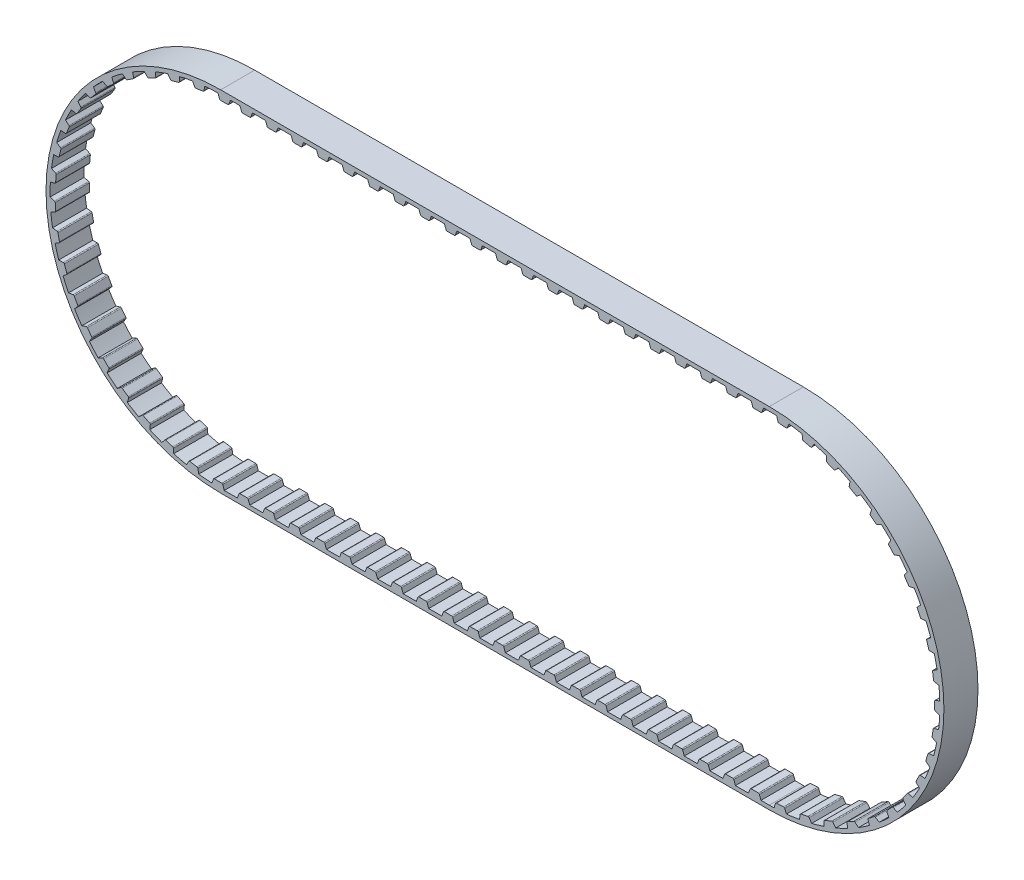
from build123d import *

# Parameters (mm, degrees)
BOSS_EXTRUDE1_DEPTH      = 6.35
BOSS_EXTRUDE1_DEPTH_BACK = 6.35
BOSS_EXTRUDE2_DEPTH      = 6.35
CRVPATTERN1_START        = -6.35
CRVPATTERN1_DEPTH        = 12.7


# Read off the part's stored shape, not the designer's step: CrvPattern1
with BuildPart() as part:
    # Sketch4 → Boss-Extrude1 (new, two sides: drawn at the far end of the back side and taken through both)
    with BuildSketch(Plane.XY.offset(-BOSS_EXTRUDE1_DEPTH_BACK)):
        with BuildLine():
            Line((-102.235, -65.084822428), (102.235, -65.084822428))
            ThreePointArc((102.235, -65.084822428), (167.319822428, 0), (102.235, 65.084822428))
            Line((102.235, 65.084822428), (-102.235, 65.084822428))
            ThreePointArc((-102.235, 65.084822428), (-167.319822428, 0), (-102.235, -65.084822428))
        make_face()
        with BuildLine():
            Line((-102.235, -63.560822428), (102.235, -63.560822428))
            ThreePointArc((102.235, -63.560822428), (165.795822428, 0), (102.235, 63.560822428))
            Line((102.235, 63.560822428), (-102.235, 63.560822428))
            ThreePointArc((-102.235, 63.560822428), (-165.795822428, 0), (-102.235, -63.560822428))
        make_face(mode=Mode.SUBTRACT)
    extrude(amount=BOSS_EXTRUDE1_DEPTH + BOSS_EXTRUDE1_DEPTH_BACK)

    # Sketch5 → Boss-Extrude2 (add, symmetric)
    with BuildSketch(Plane.XY):
        with BuildLine():
            Line((-95.049570389, 63.603326971), (-94.435782346, 61.916958184))
            ThreePointArc((-94.435782346, 61.916958184), (-94.290479985, 61.72759646), (-94.062841837, 61.655822428))
            Line((-94.062841837, 61.655822428), (-91.357158163, 61.655822428))
            ThreePointArc((-91.357158163, 61.655822428), (-91.129520015, 61.72759646), (-90.984217654, 61.916958184))
            Line((-90.984217654, 61.916958184), (-90.370429611, 63.603326971))
            Line((-90.370429611, 63.603326971), (-95.049570389, 63.603326971))
        make_face()
    extrude(amount=BOSS_EXTRUDE2_DEPTH, both=True)

    # CrvPattern1 outline → CrvPattern1 (add)
    with BuildSketch(Plane.XY.offset(CRVPATTERN1_START)):
        with BuildLine():
            ThreePointArc((-102.235, 63.560822428), (-102.735344741, 63.558853064), (-103.235658477, 63.552945096))
            Line((-103.235658477, 63.552945096), (-102.640207938, 61.916958184))
            ThreePointArc((-102.640207938, 61.916958184), (-102.494905577, 61.72759646), (-102.267267429, 61.655822428))
            Line((-102.267267429, 61.655822428), (-99.561583755, 61.655822428))
            ThreePointArc((-99.561583755, 61.655822428), (-99.333945607, 61.72759646), (-99.188643246, 61.916958184))
            Line((-99.188643246, 61.916958184), (-98.590325592, 63.560822428))
            Line((-98.590325592, 63.560822428), (-102.235, 63.560822428))
        make_face()
        with BuildLine():
            ThreePointArc((-108.121637287, 63.287642152), (-110.416661388, 63.032043951), (-112.700886314, 62.693248212))
            Line((-112.700886314, 62.693248212), (-111.916485406, 61.179709674))
            ThreePointArc((-111.916485406, 61.179709674), (-111.748016877, 61.010626875), (-111.513033627, 60.968751934))
            Line((-111.513033627, 60.968751934), (-108.829859216, 61.317032318))
            ThreePointArc((-108.829859216, 61.317032318), (-108.613353727, 61.417511228), (-108.493635149, 61.62400118))
            Line((-108.493635149, 61.62400118), (-108.121637287, 63.287642152))
        make_face()
        with BuildLine():
            ThreePointArc((-117.504267711, 61.699494417), (-119.735410529, 61.104122439), (-121.943454126, 60.428097634))
            Line((-121.943454126, 60.428097634), (-120.941878817, 59.048630131))
            ThreePointArc((-120.941878817, 59.048630131), (-120.750054975, 58.906594037), (-120.511453527, 58.900270515))
            Line((-120.511453527, 58.900270515), (-117.910347685, 59.645235311))
            ThreePointArc((-117.910347685, 59.645235311), (-117.711269798, 59.776911554), (-117.62372113, 59.998960803))
            Line((-117.62372113, 59.998960803), (-117.504267711, 61.699494417))
        make_face()
        with BuildLine():
            ThreePointArc((-126.544638041, 58.728354702), (-128.661888588, 57.80655419), (-130.744257638, 56.808453391))
            Line((-130.744257638, 56.808453391), (-129.547958203, 55.593977638))
            ThreePointArc((-129.547958203, 55.593977638), (-129.337078774, 55.482171982), (-129.100207369, 55.511541623))
            Line((-129.100207369, 55.511541623), (-126.639473792, 56.636492469))
            ThreePointArc((-126.639473792, 56.636492469), (-126.46228583, 56.796414526), (-126.408869473, 57.029045846))
            Line((-126.408869473, 57.029045846), (-126.544638041, 58.728354702))
        make_face()
        with BuildLine():
            ThreePointArc((-135.040108696, 54.440821), (-136.996008877, 53.213254078), (-138.906027151, 51.915449679))
            Line((-138.906027151, 51.915449679), (-137.5418186, 50.893188108))
            ThreePointArc((-137.5418186, 50.893188108), (-137.316610438, 50.814119011), (-137.086778541, 50.878523493))
            Line((-137.086778541, 50.878523493), (-134.821574484, 52.358244658))
            ThreePointArc((-134.821574484, 52.358244658), (-134.67024811, 52.542827882), (-134.652161388, 52.78082685))
            Line((-134.652161388, 52.78082685), (-135.040108696, 54.440821))
        make_face()
        with BuildLine():
            ThreePointArc((-142.800254004, 48.932998226), (-144.550962385, 47.427180763), (-146.245816891, 45.858763004))
            Line((-146.245816891, 45.858763004), (-144.74427791, 45.051629571))
            ThreePointArc((-144.74427791, 45.051629571), (-144.509789048, 45.007069364), (-144.292148333, 45.105065064))
            Line((-144.292148333, 45.105065064), (-142.273248265, 46.90638865))
            ThreePointArc((-142.273248265, 46.90638865), (-142.151175453, 47.111495614), (-142.168823781, 47.349527491))
            Line((-142.168823781, 47.349527491), (-142.800254004, 48.932998226))
        make_face()
        with BuildLine():
            ThreePointArc((-149.651130581, 42.328344031), (-151.157405096, 40.578028874), (-152.599105731, 38.774153783))
            Line((-152.599105731, 38.774153783), (-150.993893263, 38.200240355))
            ThreePointArc((-150.993893263, 38.200240355), (-150.755379761, 38.191187853), (-150.554808636, 38.320578201))
            Line((-150.554808636, 38.320578201), (-148.827466131, 40.403127603))
            ThreePointArc((-148.827466131, 40.403127603), (-148.737383139, 40.624160842), (-148.79037093, 40.856890153))
            Line((-148.79037093, 40.856890153), (-149.651130581, 42.328344031))
        make_face()
        with BuildLine():
            ThreePointArc((-155.439176273, 34.774901507), (-156.667253833, 32.819321907), (-157.823484928, 30.82042328))
            Line((-157.823484928, 30.82042328), (-156.150579753, 30.492594107))
            ThreePointArc((-156.150579753, 30.492594107), (-155.913387883, 30.519252221), (-155.734382143, 30.677136936))
            Line((-155.734382143, 30.677136936), (-154.337315521, 32.994231884))
            ThreePointArc((-154.337315521, 32.994231884), (-154.281241557, 33.226236946), (-154.36838109, 33.448447072))
            Line((-154.36838109, 33.448447072), (-155.439176273, 34.774901507))
        make_face()
        with BuildLine():
            ThreePointArc((-160.034652241, 26.441980798), (-160.95700553, 24.324971002), (-161.801850206, 22.175854082))
            Line((-161.801850206, 22.175854082), (-160.098750434, 22.101457443))
            ThreePointArc((-160.098750434, 22.101457443), (-159.868196843, 22.163228632), (-159.714768896, 22.346068736))
            Line((-159.714768896, 22.346068736), (-158.679293357, 24.845771628))
            ThreePointArc((-158.679293357, 24.845771628), (-158.658485315, 25.083548127), (-158.777823363, 25.290258235))
            Line((-158.777823363, 25.290258235), (-160.034652241, 26.441980798))
        make_face()
        with BuildLine():
            ThreePointArc((-163.334551054, 17.516364028), (-163.930505556, 15.285376736), (-164.445026649, 13.034213901))
            Line((-164.445026649, 13.034213901), (-162.749907202, 13.214917394))
            ThreePointArc((-162.749907202, 13.214917394), (-162.53115974, 13.31041706), (-162.406748668, 13.514114196))
            Line((-162.406748668, 13.514114196), (-161.756074358, 16.140394282))
            ThreePointArc((-161.756074358, 16.140394282), (-161.770998651, 16.378612467), (-161.919860255, 16.565189157))
            Line((-161.919860255, 16.565189157), (-163.334551054, 17.516364028))
        make_face()
        with BuildLine():
            ThreePointArc((-165.264905596, 8.198118579), (-165.521103012, 5.903161292), (-165.693767551, 3.600412278))
            Line((-165.693767551, 3.600412278), (-164.044624471, 4.03216544))
            ThreePointArc((-164.044624471, 4.03216544), (-163.842586356, 4.159252962), (-163.749980828, 4.379241267))
            Line((-163.749980828, 4.379241267), (-163.498692589, 7.07323057))
            ThreePointArc((-163.498692589, 7.07323057), (-163.549014689, 7.306550789), (-163.724063121, 7.468811951))
            Line((-163.724063121, 7.468811951), (-165.264905596, 8.198118579))
        make_face()
        with BuildLine():
            ThreePointArc((-165.78244704, -1.303887407), (-165.693144714, -3.611373303), (-165.52008243, -5.914092459))
            Line((-165.52008243, -5.914092459), (-163.9538812, -5.240967358))
            ThreePointArc((-163.9538812, -5.240967358), (-163.773081107, -5.085140644), (-163.714356874, -4.8537922))
            Line((-163.714356874, -4.8537922), (-163.868087323, -2.152479354))
            ThreePointArc((-163.868087323, -2.152479354), (-163.952679263, -1.929286966), (-164.149990817, -1.794978409))
            Line((-164.149990817, -1.794978409), (-165.78244704, -1.303887407))
        make_face()
        with BuildLine():
            ThreePointArc((-164.875574713, -10.776666803), (-164.442774353, -13.044959093), (-163.927864429, -15.296033023))
            Line((-163.927864429, -15.296033023), (-162.479711395, -14.39662406))
            ThreePointArc((-162.479711395, -14.39662406), (-162.324201954, -14.215551003), (-162.300675315, -13.978028087))
            Line((-162.300675315, -13.978028087), (-162.85597859, -11.32994153))
            ThreePointArc((-162.85597859, -11.32994153), (-162.972944244, -11.121879822), (-163.188096191, -11.018534392))
            Line((-163.188096191, -11.018534392), (-164.875574713, -10.776666803))
        make_face()
        with BuildLine():
            ThreePointArc((-162.564616124, -20.007887595), (-161.798018936, -22.186142588), (-160.952803061, -24.335113549))
            Line((-160.952803061, -24.335113549), (-159.655158521, -23.229580944))
            ThreePointArc((-159.655158521, -23.229580944), (-159.528425469, -23.027320291), (-159.540623775, -22.788946971))
            Line((-159.540623775, -22.788946971), (-160.485052773, -20.253443468))
            ThreePointArc((-160.485052773, -20.253443468), (-160.631770359, -20.065176137), (-160.859940075, -19.995110318))
            Line((-160.859940075, -19.995110318), (-162.564616124, -20.007887595))
        make_face()
        with BuildLine():
            ThreePointArc((-158.90137133, -28.790632296), (-157.818160562, -30.830024484), (-156.661584219, -32.828723368))
            Line((-156.661584219, -32.828723368), (-155.54353483, -31.541847594))
            ThreePointArc((-155.54353483, -31.541847594), (-155.448418885, -31.32293301), (-155.496068711, -31.089052416))
            Line((-155.496068711, -31.089052416), (-156.808454088, -28.722965189))
            ThreePointArc((-156.808454088, -28.722965189), (-156.981634937, -28.558712239), (-157.217708006, -28.523496555))
            Line((-157.217708006, -28.523496555), (-158.90137133, -28.790632296))
        make_face()
        with BuildLine():
            ThreePointArc((-153.967951832, -36.928035995), (-152.592407615, -38.782852474), (-151.150395422, -40.586478517))
            Line((-151.150395422, -40.586478517), (-150.237002222, -39.14710485))
            ThreePointArc((-150.237002222, -39.14710485), (-150.175635403, -38.916443297), (-150.25766868, -38.692297854))
            Line((-150.25766868, -38.692297854), (-151.908593365, -36.548662664))
            ThreePointArc((-151.908593365, -36.548662664), (-152.104355636, -36.41210582), (-152.343040488, -36.412529628))
            Line((-152.343040488, -36.412529628), (-153.967951832, -36.928035995))
        make_face()
        with BuildLine():
            ThreePointArc((-147.874940054, -44.237699077), (-146.237895162, -45.866364201), (-144.542769772, -47.434489189))
            Line((-144.542769772, -47.434489189), (-143.854506436, -45.874881138))
            ThreePointArc((-143.854506436, -45.874881138), (-143.828264279, -45.637642888), (-143.942842233, -45.428256807))
            Line((-143.942842233, -45.428256807), (-145.895300809, -43.555123162))
            ThreePointArc((-145.895300809, -43.555123162), (-146.109256496, -43.44932334), (-146.345203019, -43.485377141))
            Line((-146.345203019, -43.485377141), (-147.874940054, -44.237699077))
        make_face()
        with BuildLine():
            ThreePointArc((-140.758910638, -50.555775703), (-138.897059375, -51.921783002), (-136.986816963, -53.219257469))
            Line((-136.986816963, -53.219257469), (-136.539110889, -51.574373593))
            ThreePointArc((-136.539110889, -51.574373593), (-136.548581612, -51.335876332), (-136.693135982, -51.145942996))
            Line((-136.693135982, -51.145942996), (-138.903364158, -49.585297118))
            ThreePointArc((-138.903364158, -49.585297118), (-139.130717452, -49.512625819), (-139.358636913, -49.583501467))
            Line((-139.358636913, -49.583501467), (-140.758910638, -50.555775703))
        make_face()
        with BuildLine():
            ThreePointArc((-132.779369131, -55.740646409), (-130.734444828, -56.813376878), (-128.651903409, -57.811117979))
            Line((-128.651903409, -57.811117979), (-128.454789913, -56.117828293))
            ThreePointArc((-128.454789913, -56.117828293), (-128.499761229, -55.883417929), (-128.671051835, -55.717194686))
            Line((-128.671051835, -55.717194686), (-131.089507425, -54.504018398))
            ThreePointArc((-131.089507425, -54.504018398), (-131.325162211, -54.466104545), (-131.539945803, -54.570213367))
            Line((-131.539945803, -54.570213367), (-132.779369131, -55.740646409))
        make_face()
        with BuildLine():
            ThreePointArc((-124.115176673, -59.676092504), (-121.933016234, -60.431500926), (-119.724855901, -61.107144331))
            Line((-119.724855901, -61.107144331), (-119.782753277, -59.403403862))
            ThreePointArc((-119.782753277, -59.403403862), (-119.862217155, -59.178334694), (-120.056404524, -59.039547433))
            Line((-120.056404524, -59.039547433), (-122.628877932, -58.201034039))
            ThreePointArc((-122.628877932, -58.201034039), (-122.867552015, -58.19872747), (-123.064385372, -58.333735869))
            Line((-123.064385372, -58.333735869), (-124.115176673, -59.676092504))
        make_face()
        with BuildLine():
            ThreePointArc((-114.960540831, -62.273901101), (-112.690057306, -62.695055024), (-110.405773894, -63.033456209))
            Line((-110.405773894, -63.033456209), (-110.717384373, -61.35745424))
            ThreePointArc((-110.717384373, -61.35745424), (-110.829559633, -61.146771186), (-111.042291063, -61.038530818))
            Line((-111.042291063, -61.038530818), (-113.711120388, -60.593475566))
            ThreePointArc((-113.711120388, -60.593475566), (-113.947463898, -60.626827982), (-114.121935006, -60.789709751))
            Line((-114.121935006, -60.789709751), (-114.960540831, -62.273901101))
        make_face()
        with BuildLine():
            Line((-102.235, -63.560822428), (-100.898709621, -63.560822428))
            Line((-100.898709621, -63.560822428), (-101.461883124, -61.936179457))
            ThreePointArc((-101.461883124, -61.936179457), (-101.604255363, -61.744604971), (-101.830762484, -61.6693377))
            Line((-101.830762484, -61.6693377), (-104.536126012, -61.627716487))
            ThreePointArc((-104.536126012, -61.627716487), (-104.764841317, -61.695980296), (-104.913039414, -61.883084444))
            Line((-104.913039414, -61.883084444), (-105.520662443, -63.475842413))
            ThreePointArc((-105.520662443, -63.475842413), (-103.878380608, -63.539573873), (-102.235, -63.560822428))
        make_face()
        with BuildLine():
            Line((-96.011887204, -63.560822428), (-91.363687204, -63.560822428))
            Line((-91.363687204, -63.560822428), (-91.962004858, -61.916958184))
            ThreePointArc((-91.962004858, -61.916958184), (-92.107307219, -61.72759646), (-92.334945367, -61.655822428))
            Line((-92.334945367, -61.655822428), (-95.040629041, -61.655822428))
            ThreePointArc((-95.040629041, -61.655822428), (-95.268267189, -61.72759646), (-95.41356955, -61.916958184))
            Line((-95.41356955, -61.916958184), (-96.011887204, -63.560822428))
        make_face()
        with BuildLine():
            Line((-86.486887204, -63.560822428), (-81.838687204, -63.560822428))
            Line((-81.838687204, -63.560822428), (-82.437004858, -61.916958184))
            ThreePointArc((-82.437004858, -61.916958184), (-82.582307219, -61.72759646), (-82.809945367, -61.655822428))
            Line((-82.809945367, -61.655822428), (-85.515629041, -61.655822428))
            ThreePointArc((-85.515629041, -61.655822428), (-85.743267189, -61.72759646), (-85.88856955, -61.916958184))
            Line((-85.88856955, -61.916958184), (-86.486887204, -63.560822428))
        make_face()
        with BuildLine():
            Line((-76.961887204, -63.560822428), (-72.313687204, -63.560822428))
            Line((-72.313687204, -63.560822428), (-72.912004858, -61.916958184))
            ThreePointArc((-72.912004858, -61.916958184), (-73.057307219, -61.72759646), (-73.284945367, -61.655822428))
            Line((-73.284945367, -61.655822428), (-75.990629041, -61.655822428))
            ThreePointArc((-75.990629041, -61.655822428), (-76.218267189, -61.72759646), (-76.36356955, -61.916958184))
            Line((-76.36356955, -61.916958184), (-76.961887204, -63.560822428))
        make_face()
        with BuildLine():
            Line((-67.436887204, -63.560822428), (-62.788687204, -63.560822428))
            Line((-62.788687204, -63.560822428), (-63.387004858, -61.916958184))
            ThreePointArc((-63.387004858, -61.916958184), (-63.532307219, -61.72759646), (-63.759945367, -61.655822428))
            Line((-63.759945367, -61.655822428), (-66.465629041, -61.655822428))
            ThreePointArc((-66.465629041, -61.655822428), (-66.693267189, -61.72759646), (-66.83856955, -61.916958184))
            Line((-66.83856955, -61.916958184), (-67.436887204, -63.560822428))
        make_face()
        with BuildLine():
            Line((-57.911887204, -63.560822428), (-53.263687204, -63.560822428))
            Line((-53.263687204, -63.560822428), (-53.862004858, -61.916958184))
            ThreePointArc((-53.862004858, -61.916958184), (-54.007307219, -61.72759646), (-54.234945367, -61.655822428))
            Line((-54.234945367, -61.655822428), (-56.940629041, -61.655822428))
            ThreePointArc((-56.940629041, -61.655822428), (-57.168267189, -61.72759646), (-57.31356955, -61.916958184))
            Line((-57.31356955, -61.916958184), (-57.911887204, -63.560822428))
        make_face()
        with BuildLine():
            Line((-48.386887204, -63.560822428), (-43.738687204, -63.560822428))
            Line((-43.738687204, -63.560822428), (-44.337004858, -61.916958184))
            ThreePointArc((-44.337004858, -61.916958184), (-44.482307219, -61.72759646), (-44.709945367, -61.655822428))
            Line((-44.709945367, -61.655822428), (-47.415629041, -61.655822428))
            ThreePointArc((-47.415629041, -61.655822428), (-47.643267189, -61.72759646), (-47.78856955, -61.916958184))
            Line((-47.78856955, -61.916958184), (-48.386887204, -63.560822428))
        make_face()
        with BuildLine():
            Line((-38.861887204, -63.560822428), (-34.213687204, -63.560822428))
            Line((-34.213687204, -63.560822428), (-34.812004858, -61.916958184))
            ThreePointArc((-34.812004858, -61.916958184), (-34.957307219, -61.72759646), (-35.184945367, -61.655822428))
            Line((-35.184945367, -61.655822428), (-37.890629041, -61.655822428))
            ThreePointArc((-37.890629041, -61.655822428), (-38.118267189, -61.72759646), (-38.26356955, -61.916958184))
            Line((-38.26356955, -61.916958184), (-38.861887204, -63.560822428))
        make_face()
        with BuildLine():
            Line((-29.336887204, -63.560822428), (-24.688687204, -63.560822428))
            Line((-24.688687204, -63.560822428), (-25.287004858, -61.916958184))
            ThreePointArc((-25.287004858, -61.916958184), (-25.432307219, -61.72759646), (-25.659945367, -61.655822428))
            Line((-25.659945367, -61.655822428), (-28.365629041, -61.655822428))
            ThreePointArc((-28.365629041, -61.655822428), (-28.593267189, -61.72759646), (-28.73856955, -61.916958184))
            Line((-28.73856955, -61.916958184), (-29.336887204, -63.560822428))
        make_face()
        with BuildLine():
            Line((-19.811887204, -63.560822428), (-15.163687204, -63.560822428))
            Line((-15.163687204, -63.560822428), (-15.762004858, -61.916958184))
            ThreePointArc((-15.762004858, -61.916958184), (-15.907307219, -61.72759646), (-16.134945367, -61.655822428))
            Line((-16.134945367, -61.655822428), (-18.840629041, -61.655822428))
            ThreePointArc((-18.840629041, -61.655822428), (-19.068267189, -61.72759646), (-19.21356955, -61.916958184))
            Line((-19.21356955, -61.916958184), (-19.811887204, -63.560822428))
        make_face()
        with BuildLine():
            Line((-10.286887204, -63.560822428), (-5.638687204, -63.560822428))
            Line((-5.638687204, -63.560822428), (-6.237004858, -61.916958184))
            ThreePointArc((-6.237004858, -61.916958184), (-6.382307219, -61.72759646), (-6.609945367, -61.655822428))
            Line((-6.609945367, -61.655822428), (-9.315629041, -61.655822428))
            ThreePointArc((-9.315629041, -61.655822428), (-9.543267189, -61.72759646), (-9.68856955, -61.916958184))
            Line((-9.68856955, -61.916958184), (-10.286887204, -63.560822428))
        make_face()
        with BuildLine():
            Line((-0.761887204, -63.560822428), (3.886312796, -63.560822428))
            Line((3.886312796, -63.560822428), (3.287995142, -61.916958184))
            ThreePointArc((3.287995142, -61.916958184), (3.142692781, -61.72759646), (2.915054633, -61.655822428))
            Line((2.915054633, -61.655822428), (0.209370959, -61.655822428))
            ThreePointArc((0.209370959, -61.655822428), (-0.018267189, -61.72759646), (-0.16356955, -61.916958184))
            Line((-0.16356955, -61.916958184), (-0.761887204, -63.560822428))
        make_face()
        with BuildLine():
            Line((8.763112796, -63.560822428), (13.411312796, -63.560822428))
            Line((13.411312796, -63.560822428), (12.812995142, -61.916958184))
            ThreePointArc((12.812995142, -61.916958184), (12.667692781, -61.72759646), (12.440054633, -61.655822428))
            Line((12.440054633, -61.655822428), (9.734370959, -61.655822428))
            ThreePointArc((9.734370959, -61.655822428), (9.506732811, -61.72759646), (9.36143045, -61.916958184))
            Line((9.36143045, -61.916958184), (8.763112796, -63.560822428))
        make_face()
        with BuildLine():
            Line((18.288112796, -63.560822428), (22.936312796, -63.560822428))
            Line((22.936312796, -63.560822428), (22.337995142, -61.916958184))
            ThreePointArc((22.337995142, -61.916958184), (22.192692781, -61.72759646), (21.965054633, -61.655822428))
            Line((21.965054633, -61.655822428), (19.259370959, -61.655822428))
            ThreePointArc((19.259370959, -61.655822428), (19.031732811, -61.72759646), (18.88643045, -61.916958184))
            Line((18.88643045, -61.916958184), (18.288112796, -63.560822428))
        make_face()
        with BuildLine():
            Line((27.813112796, -63.560822428), (32.461312796, -63.560822428))
            Line((32.461312796, -63.560822428), (31.862995142, -61.916958184))
            ThreePointArc((31.862995142, -61.916958184), (31.717692781, -61.72759646), (31.490054633, -61.655822428))
            Line((31.490054633, -61.655822428), (28.784370959, -61.655822428))
            ThreePointArc((28.784370959, -61.655822428), (28.556732811, -61.72759646), (28.41143045, -61.916958184))
            Line((28.41143045, -61.916958184), (27.813112796, -63.560822428))
        make_face()
        with BuildLine():
            Line((37.338112796, -63.560822428), (41.986312796, -63.560822428))
            Line((41.986312796, -63.560822428), (41.387995142, -61.916958184))
            ThreePointArc((41.387995142, -61.916958184), (41.242692781, -61.72759646), (41.015054633, -61.655822428))
            Line((41.015054633, -61.655822428), (38.309370959, -61.655822428))
            ThreePointArc((38.309370959, -61.655822428), (38.081732811, -61.72759646), (37.93643045, -61.916958184))
            Line((37.93643045, -61.916958184), (37.338112796, -63.560822428))
        make_face()
        with BuildLine():
            Line((46.863112796, -63.560822428), (51.511312796, -63.560822428))
            Line((51.511312796, -63.560822428), (50.912995142, -61.916958184))
            ThreePointArc((50.912995142, -61.916958184), (50.767692781, -61.72759646), (50.540054633, -61.655822428))
            Line((50.540054633, -61.655822428), (47.834370959, -61.655822428))
            ThreePointArc((47.834370959, -61.655822428), (47.606732811, -61.72759646), (47.46143045, -61.916958184))
            Line((47.46143045, -61.916958184), (46.863112796, -63.560822428))
        make_face()
        with BuildLine():
            Line((56.388112796, -63.560822428), (61.036312796, -63.560822428))
            Line((61.036312796, -63.560822428), (60.437995142, -61.916958184))
            ThreePointArc((60.437995142, -61.916958184), (60.292692781, -61.72759646), (60.065054633, -61.655822428))
            Line((60.065054633, -61.655822428), (57.359370959, -61.655822428))
            ThreePointArc((57.359370959, -61.655822428), (57.131732811, -61.72759646), (56.98643045, -61.916958184))
            Line((56.98643045, -61.916958184), (56.388112796, -63.560822428))
        make_face()
        with BuildLine():
            Line((65.913112796, -63.560822428), (70.561312796, -63.560822428))
            Line((70.561312796, -63.560822428), (69.962995142, -61.916958184))
            ThreePointArc((69.962995142, -61.916958184), (69.817692781, -61.72759646), (69.590054633, -61.655822428))
            Line((69.590054633, -61.655822428), (66.884370959, -61.655822428))
            ThreePointArc((66.884370959, -61.655822428), (66.656732811, -61.72759646), (66.51143045, -61.916958184))
            Line((66.51143045, -61.916958184), (65.913112796, -63.560822428))
        make_face()
        with BuildLine():
            Line((75.438112796, -63.560822428), (80.086312796, -63.560822428))
            Line((80.086312796, -63.560822428), (79.487995142, -61.916958184))
            ThreePointArc((79.487995142, -61.916958184), (79.342692781, -61.72759646), (79.115054633, -61.655822428))
            Line((79.115054633, -61.655822428), (76.409370959, -61.655822428))
            ThreePointArc((76.409370959, -61.655822428), (76.181732811, -61.72759646), (76.03643045, -61.916958184))
            Line((76.03643045, -61.916958184), (75.438112796, -63.560822428))
        make_face()
        with BuildLine():
            Line((84.963112796, -63.560822428), (89.611312796, -63.560822428))
            Line((89.611312796, -63.560822428), (89.012995142, -61.916958184))
            ThreePointArc((89.012995142, -61.916958184), (88.867692781, -61.72759646), (88.640054633, -61.655822428))
            Line((88.640054633, -61.655822428), (85.934370959, -61.655822428))
            ThreePointArc((85.934370959, -61.655822428), (85.706732811, -61.72759646), (85.56143045, -61.916958184))
            Line((85.56143045, -61.916958184), (84.963112796, -63.560822428))
        make_face()
        with BuildLine():
            Line((94.488112796, -63.560822428), (99.136312796, -63.560822428))
            Line((99.136312796, -63.560822428), (98.537995142, -61.916958184))
            ThreePointArc((98.537995142, -61.916958184), (98.392692781, -61.72759646), (98.165054633, -61.655822428))
            Line((98.165054633, -61.655822428), (95.459370959, -61.655822428))
            ThreePointArc((95.459370959, -61.655822428), (95.231732811, -61.72759646), (95.08643045, -61.916958184))
            Line((95.08643045, -61.916958184), (94.488112796, -63.560822428))
        make_face()
        with BuildLine():
            ThreePointArc((104.027634738, -63.535538153), (106.334365492, -63.428490052), (108.635685393, -63.237721134))
            Line((108.635685393, -63.237721134), (107.950533504, -61.67674369))
            ThreePointArc((107.950533504, -61.67674369), (107.793320745, -61.497147513), (107.561527457, -61.440204472))
            Line((107.561527457, -61.440204472), (104.861476963, -61.614707977))
            ThreePointArc((104.861476963, -61.614707977), (104.63894183, -61.701014136), (104.506154901, -61.899352911))
            Line((104.506154901, -61.899352911), (104.027634738, -63.535538153))
        make_face()
        with BuildLine():
            ThreePointArc((113.493158556, -62.555831172), (115.75805479, -62.105596663), (118.005101613, -61.573387456))
            Line((118.005101613, -61.573387456), (117.094580543, -60.132195216))
            ThreePointArc((117.094580543, -60.132195216), (116.912316716, -59.978083129), (116.674619867, -59.956384134))
            Line((116.674619867, -59.956384134), (114.030882852, -60.532039186))
            ThreePointArc((114.030882852, -60.532039186), (113.82372696, -60.650601722), (113.722039465, -60.866542203))
            Line((113.722039465, -60.866542203), (113.493158556, -62.555831172))
        make_face()
        with BuildLine():
            ThreePointArc((122.706331148, -60.173937454), (124.878625294, -59.390608527), (127.021031565, -58.528888482))
            Line((127.021031565, -58.528888482), (125.905550612, -57.239785719))
            ThreePointArc((125.905550612, -57.239785719), (125.702321153, -57.114612138), (125.46404871, -57.128643572))
            Line((125.46404871, -57.128643572), (122.935884446, -58.092546884))
            ThreePointArc((122.935884446, -58.092546884), (122.748751186, -58.24070822), (122.680442446, -58.46941011))
            Line((122.680442446, -58.46941011), (122.706331148, -60.173937454))
        make_face()
        with BuildLine():
            ThreePointArc((131.460639579, -56.443247062), (133.491639741, -55.344382008), (135.481383499, -54.172466549))
            Line((135.481383499, -54.172466549), (134.185946128, -53.064348455))
            ThreePointArc((134.185946128, -53.064348455), (133.966306419, -52.970919142), (133.73279925, -53.02036649))
            Line((133.73279925, -53.02036649), (131.376876448, -54.350912204))
            ThreePointArc((131.376876448, -54.350912204), (131.213960407, -54.52535131), (131.18056156, -54.761688263))
            Line((131.18056156, -54.761688263), (131.460639579, -56.443247062))
        make_face()
        with BuildLine():
            ThreePointArc((139.559856335, -51.447383289), (141.404037716, -50.057613128), (143.196518926, -48.601770699))
            Line((143.196518926, -48.601770699), (141.750162319, -47.699475703))
            ThreePointArc((141.750162319, -47.699475703), (141.519035577, -47.639884871), (141.295527737, -47.723639774))
            Line((141.295527737, -47.723639774), (139.164654324, -49.391003754))
            ThreePointArc((139.164654324, -49.391003754), (139.029607258, -49.587810584), (139.031866938, -49.826485115))
            Line((139.031866938, -49.826485115), (139.559856335, -51.447383289))
        make_face()
        with BuildLine():
            ThreePointArc((146.822437761, -45.298328244), (148.4384631, -43.648804626), (149.993503358, -41.941667882))
            Line((149.993503358, -41.941667882), (148.428647549, -41.265420894))
            ThreePointArc((148.428647549, -41.265420894), (148.191214471, -41.241004271), (147.98271588, -41.357189364))
            Line((147.98271588, -41.357189364), (146.124655308, -43.323997706))
            ThreePointArc((146.124655308, -43.323997706), (146.020504292, -43.538760841), (146.058371849, -43.774423071))
            Line((146.058371849, -43.774423071), (146.822437761, -45.298328244))
        make_face()
        with BuildLine():
            ThreePointArc((153.08559335, -38.133912777), (154.437239498, -36.261609715), (155.719982632, -34.341444067))
            Line((155.719982632, -34.341444067), (154.071703807, -33.906403139))
            ThreePointArc((154.071703807, -33.906403139), (153.833286446, -33.917708023), (153.644470593, -34.063719022))
            Line((153.644470593, -34.063719022), (152.100871224, -36.285885787))
            ThreePointArc((152.100871224, -36.285885787), (152.029950801, -36.513791319), (152.102577434, -36.741158886))
            Line((152.102577434, -36.741158886), (153.08559335, -38.133912777))
        make_face()
        with BuildLine():
            ThreePointArc((158.208934692, -30.114727009), (159.265904548, -28.06161211), (160.247597916, -25.971458001))
            Line((160.247597916, -25.971458001), (158.552842188, -25.78737456))
            ThreePointArc((158.552842188, -25.78737456), (158.318784662, -25.834147552), (158.153883847, -26.006711626))
            Line((158.153883847, -26.006711626), (156.959345406, -28.434427024))
            ThreePointArc((156.959345406, -28.434427024), (156.923245253, -28.67036646), (157.029003039, -28.884342928))
            Line((157.029003039, -28.884342928), (158.208934692, -30.114727009))
        make_face()
        with BuildLine():
            ThreePointArc((162.077622274, -21.420520702), (162.816223895, -19.232614463), (163.474862876, -17.019322626))
            Line((163.474862876, -17.019322626), (161.771618133, -17.090322895))
            ThreePointArc((161.771618133, -17.090322895), (161.547166833, -17.17151558), (161.409877303, -17.366764711))
            Line((161.409877303, -17.366764711), (160.591175326, -19.945611589))
            ThreePointArc((160.591175326, -19.945611589), (160.590704627, -20.184296353), (160.727223009, -20.380085447))
            Line((160.727223009, -20.380085447), (162.077622274, -21.420520702))
        make_face()
        with BuildLine():
            ThreePointArc((164.604939599, -12.246174184), (165.008617257, -9.972518446), (165.329438481, -7.685699737))
            Line((165.329438481, -7.685699737), (163.655882895, -8.010192249))
            ThreePointArc((163.655882895, -8.010192249), (163.446068888, -8.123984696), (163.339467982, -8.337542381))
            Line((163.339467982, -8.337542381), (162.914953646, -11.009715976))
            ThreePointArc((162.914953646, -11.009715976), (162.950122952, -11.245795958), (163.114341875, -11.419009074))
            Line((163.114341875, -11.419009074), (164.604939599, -12.246174184))
        make_face()
        with BuildLine():
            ThreePointArc((165.73423694, -2.797330105), (165.793942215, -0.488888781), (165.769754486, 1.820197839))
            Line((165.769754486, 1.820197839), (164.163400744, 1.249486573))
            ThreePointArc((164.163400744, 1.249486573), (163.972927005, 1.105645018), (163.899404178, 0.878565665))
            Line((163.899404178, 0.878565665), (163.878592956, -1.827037971))
            ThreePointArc((163.878592956, -1.827037971), (163.948613948, -2.055221447), (164.136852452, -2.201976017))
            Line((164.136852452, -2.201976017), (165.73423694, -2.797330105))
        make_face()
        with BuildLine():
            ThreePointArc((165.440201138, 6.714216029), (165.154595737, 9.005699309), (164.785941221, 11.285295745))
            Line((164.785941221, 11.285295745), (163.282795687, 10.481158197))
            ThreePointArc((163.282795687, 10.481158197), (163.115931677, 10.310491737), (163.077134942, 10.074980694))
            Line((163.077134942, 10.074980694), (163.460493317, 7.396593026))
            ThreePointArc((163.460493317, 7.396593026), (163.563796477, 7.18142078), (163.771835202, 7.064414254))
            Line((163.771835202, 7.064414254), (165.440201138, 6.714216029))
        make_face()
        with BuildLine():
            ThreePointArc((163.729422993, 16.075263248), (163.104908752, 18.298424967), (162.400050828, 20.497434146))
            Line((162.400050828, 20.497434146), (161.033806455, 19.477895032))
            ThreePointArc((161.033806455, 19.477895032), (160.894292425, 19.28422915), (160.891091409, 19.045565387))
            Line((160.891091409, 19.045565387), (161.670026416, 16.454429652))
            ThreePointArc((161.670026416, 16.454429652), (161.804296208, 16.257091716), (162.027471973, 16.17245593))
            Line((162.027471973, 16.17245593), (163.729422993, 16.075263248))
        make_face()
        with BuildLine():
            ThreePointArc((160.640249538, 25.075984012), (159.690824921, 27.180992079), (158.665562954, 29.250123289))
            Line((158.665562954, 29.250123289), (157.466844061, 28.038035541))
            ThreePointArc((157.466844061, 28.038035541), (157.357807214, 27.825711251), (157.390273667, 27.589244408))
            Line((157.390273667, 27.589244408), (158.547325507, 25.143440822))
            ThreePointArc((158.547325507, 25.143440822), (158.709552277, 24.968360517), (158.942862605, 24.91799258))
            Line((158.942862605, 24.91799258), (160.640249538, 25.075984012))
        make_face()
        with BuildLine():
            ThreePointArc((156.241924485, 33.514627483), (154.988870812, 35.454298217), (153.666186013, 37.347171955))
            Line((153.666186013, 37.347171955), (152.661861842, 35.969704477))
            ThreePointArc((152.661861842, 35.969704477), (152.585746234, 35.74348102), (152.653152422, 35.514511494))
            Line((152.653152422, 35.514511494), (154.162385818, 33.268862657))
            ThreePointArc((154.162385818, 33.268862657), (154.348933259, 33.119964402), (154.587148508, 33.10499331))
            Line((154.587148508, 33.10499331), (156.241924485, 33.514627483))
        make_face()
        with BuildLine():
            ThreePointArc((150.633036136, 41.202041768), (149.10444056, 42.932897519), (147.513980861, 44.607085087))
            Line((147.513980861, 44.607085087), (146.726563303, 43.095113764))
            ThreePointArc((146.726563303, 43.095113764), (146.685075062, 42.860061931), (146.785910078, 42.643722064))
            Line((146.785910078, 42.643722064), (148.613495617, 40.648564115))
            ThreePointArc((148.613495617, 40.648564115), (148.820182276, 40.52918546), (149.057962859, 40.549946789))
            Line((149.057962859, 40.549946789), (150.633036136, 41.202041768))
        make_face()
        with BuildLine():
            ThreePointArc((143.939307523, 47.965913748), (142.169433459, 49.449157445), (140.346848959, 50.867131988))
            Line((140.346848959, 50.867131988), (139.79398795, 49.254547603))
            ThreePointArc((139.79398795, 49.254547603), (139.788057035, 49.015936073), (139.920060665, 48.817075117))
            Line((139.920060665, 48.817075117), (142.025033082, 47.11712945))
            ThreePointArc((142.025033082, 47.11712945), (142.247226084, 47.029946264), (142.479242158, 47.085974648))
            Line((142.479242158, 47.085974648), (143.939307523, 47.965913748))
        make_face()
        with BuildLine():
            ThreePointArc((136.310778336, 53.654631473), (134.339297449, 54.857016261), (132.325441314, 55.986993929))
            Line((132.325441314, 55.986993929), (132.019529214, 54.309942505))
            ThreePointArc((132.019529214, 54.309942505), (132.049288566, 54.073119746), (132.209501954, 53.896195162))
            Line((132.209501954, 53.896195162), (134.544678367, 52.529566))
            ThreePointArc((134.544678367, 52.529566), (134.777397264, 52.476532489), (134.998448196, 52.566572056))
            Line((134.998448196, 52.566572056), (136.310778336, 53.654631473))
        make_face()
        with BuildLine():
            ThreePointArc((127.918441786, 58.140682536), (125.789544751, 59.035257002), (123.629557495, 59.851909387))
            Line((123.629557495, 59.851909387), (123.577451312, 58.147981972))
            ThreePointArc((123.577451312, 58.147981972), (123.642233876, 57.918256358), (123.827065844, 57.767233904))
            Line((123.827065844, 57.767233904), (126.340103356, 56.764554191))
            ThreePointArc((126.340103356, 56.764554191), (126.578131762, 56.7468591), (126.783262705, 56.868891616))
            Line((126.783262705, 56.868891616), (127.918441786, 58.140682536))
        make_face()
        with BuildLine():
            ThreePointArc((118.9504118, 61.323512261), (116.711817766, 61.890224552), (114.454115427, 62.37524642))
            Line((114.454115427, 62.37524642), (114.656983121, 60.682636485))
            ThreePointArc((114.656983121, 60.682636485), (114.755336798, 60.465157308), (114.960644345, 60.343422146))
            Line((114.960644345, 60.343422146), (117.595213309, 59.727166913))
            ThreePointArc((117.595213309, 59.727166913), (117.833215826, 59.745206877), (118.017828775, 59.896496987))
            Line((118.017828775, 59.896496987), (118.9504118, 61.323512261))
        make_face()
        with BuildLine():
            ThreePointArc((109.60770645, 63.131777635), (107.309593426, 63.357924913), (105.004782321, 63.500444515))
            Line((105.004782321, 63.500444515), (105.458076619, 61.857091853))
            ThreePointArc((105.458076619, 61.857091853), (105.587796815, 61.656733901), (105.808977978, 61.567014722))
            Line((105.808977978, 61.567014722), (108.506024626, 61.350997306))
            ThreePointArc((108.506024626, 61.350997306), (108.738666435, 61.404367961), (108.898623299, 61.581524502))
            Line((108.898623299, 61.581524502), (109.60770645, 63.131777635))
        make_face()
        with BuildLine():
            Line((100.1141, 63.560822428), (95.4659, 63.560822428))
            Line((95.4659, 63.560822428), (96.064217654, 61.916958184))
            ThreePointArc((96.064217654, 61.916958184), (96.209520015, 61.72759646), (96.437158163, 61.655822428))
            Line((96.437158163, 61.655822428), (99.142841837, 61.655822428))
            ThreePointArc((99.142841837, 61.655822428), (99.370479985, 61.72759646), (99.515782346, 61.916958184))
            Line((99.515782346, 61.916958184), (100.1141, 63.560822428))
        make_face()
        with BuildLine():
            Line((90.5891, 63.560822428), (85.9409, 63.560822428))
            Line((85.9409, 63.560822428), (86.539217654, 61.916958184))
            ThreePointArc((86.539217654, 61.916958184), (86.684520015, 61.72759646), (86.912158163, 61.655822428))
            Line((86.912158163, 61.655822428), (89.617841837, 61.655822428))
            ThreePointArc((89.617841837, 61.655822428), (89.845479985, 61.72759646), (89.990782346, 61.916958184))
            Line((89.990782346, 61.916958184), (90.5891, 63.560822428))
        make_face()
        with BuildLine():
            Line((81.0641, 63.560822428), (76.4159, 63.560822428))
            Line((76.4159, 63.560822428), (77.014217654, 61.916958184))
            ThreePointArc((77.014217654, 61.916958184), (77.159520015, 61.72759646), (77.387158163, 61.655822428))
            Line((77.387158163, 61.655822428), (80.092841837, 61.655822428))
            ThreePointArc((80.092841837, 61.655822428), (80.320479985, 61.72759646), (80.465782346, 61.916958184))
            Line((80.465782346, 61.916958184), (81.0641, 63.560822428))
        make_face()
        with BuildLine():
            Line((71.5391, 63.560822428), (66.8909, 63.560822428))
            Line((66.8909, 63.560822428), (67.489217654, 61.916958184))
            ThreePointArc((67.489217654, 61.916958184), (67.634520015, 61.72759646), (67.862158163, 61.655822428))
            Line((67.862158163, 61.655822428), (70.567841837, 61.655822428))
            ThreePointArc((70.567841837, 61.655822428), (70.795479985, 61.72759646), (70.940782346, 61.916958184))
            Line((70.940782346, 61.916958184), (71.5391, 63.560822428))
        make_face()
        with BuildLine():
            Line((62.0141, 63.560822428), (57.3659, 63.560822428))
            Line((57.3659, 63.560822428), (57.964217654, 61.916958184))
            ThreePointArc((57.964217654, 61.916958184), (58.109520015, 61.72759646), (58.337158163, 61.655822428))
            Line((58.337158163, 61.655822428), (61.042841837, 61.655822428))
            ThreePointArc((61.042841837, 61.655822428), (61.270479985, 61.72759646), (61.415782346, 61.916958184))
            Line((61.415782346, 61.916958184), (62.0141, 63.560822428))
        make_face()
        with BuildLine():
            Line((52.4891, 63.560822428), (47.8409, 63.560822428))
            Line((47.8409, 63.560822428), (48.439217654, 61.916958184))
            ThreePointArc((48.439217654, 61.916958184), (48.584520015, 61.72759646), (48.812158163, 61.655822428))
            Line((48.812158163, 61.655822428), (51.517841837, 61.655822428))
            ThreePointArc((51.517841837, 61.655822428), (51.745479985, 61.72759646), (51.890782346, 61.916958184))
            Line((51.890782346, 61.916958184), (52.4891, 63.560822428))
        make_face()
        with BuildLine():
            Line((42.9641, 63.560822428), (38.3159, 63.560822428))
            Line((38.3159, 63.560822428), (38.914217654, 61.916958184))
            ThreePointArc((38.914217654, 61.916958184), (39.059520015, 61.72759646), (39.287158163, 61.655822428))
            Line((39.287158163, 61.655822428), (41.992841837, 61.655822428))
            ThreePointArc((41.992841837, 61.655822428), (42.220479985, 61.72759646), (42.365782346, 61.916958184))
            Line((42.365782346, 61.916958184), (42.9641, 63.560822428))
        make_face()
        with BuildLine():
            Line((33.4391, 63.560822428), (28.7909, 63.560822428))
            Line((28.7909, 63.560822428), (29.389217654, 61.916958184))
            ThreePointArc((29.389217654, 61.916958184), (29.534520015, 61.72759646), (29.762158163, 61.655822428))
            Line((29.762158163, 61.655822428), (32.467841837, 61.655822428))
            ThreePointArc((32.467841837, 61.655822428), (32.695479985, 61.72759646), (32.840782346, 61.916958184))
            Line((32.840782346, 61.916958184), (33.4391, 63.560822428))
        make_face()
        with BuildLine():
            Line((23.9141, 63.560822428), (19.2659, 63.560822428))
            Line((19.2659, 63.560822428), (19.864217654, 61.916958184))
            ThreePointArc((19.864217654, 61.916958184), (20.009520015, 61.72759646), (20.237158163, 61.655822428))
            Line((20.237158163, 61.655822428), (22.942841837, 61.655822428))
            ThreePointArc((22.942841837, 61.655822428), (23.170479985, 61.72759646), (23.315782346, 61.916958184))
            Line((23.315782346, 61.916958184), (23.9141, 63.560822428))
        make_face()
        with BuildLine():
            Line((14.3891, 63.560822428), (9.7409, 63.560822428))
            Line((9.7409, 63.560822428), (10.339217654, 61.916958184))
            ThreePointArc((10.339217654, 61.916958184), (10.484520015, 61.72759646), (10.712158163, 61.655822428))
            Line((10.712158163, 61.655822428), (13.417841837, 61.655822428))
            ThreePointArc((13.417841837, 61.655822428), (13.645479985, 61.72759646), (13.790782346, 61.916958184))
            Line((13.790782346, 61.916958184), (14.3891, 63.560822428))
        make_face()
        with BuildLine():
            Line((4.8641, 63.560822428), (0.2159, 63.560822428))
            Line((0.2159, 63.560822428), (0.814217654, 61.916958184))
            ThreePointArc((0.814217654, 61.916958184), (0.959520015, 61.72759646), (1.187158163, 61.655822428))
            Line((1.187158163, 61.655822428), (3.892841837, 61.655822428))
            ThreePointArc((3.892841837, 61.655822428), (4.120479985, 61.72759646), (4.265782346, 61.916958184))
            Line((4.265782346, 61.916958184), (4.8641, 63.560822428))
        make_face()
        with BuildLine():
            Line((-4.6609, 63.560822428), (-9.3091, 63.560822428))
            Line((-9.3091, 63.560822428), (-8.710782346, 61.916958184))
            ThreePointArc((-8.710782346, 61.916958184), (-8.565479985, 61.72759646), (-8.337841837, 61.655822428))
            Line((-8.337841837, 61.655822428), (-5.632158163, 61.655822428))
            ThreePointArc((-5.632158163, 61.655822428), (-5.404520015, 61.72759646), (-5.259217654, 61.916958184))
            Line((-5.259217654, 61.916958184), (-4.6609, 63.560822428))
        make_face()
        with BuildLine():
            Line((-14.1859, 63.560822428), (-18.8341, 63.560822428))
            Line((-18.8341, 63.560822428), (-18.235782346, 61.916958184))
            ThreePointArc((-18.235782346, 61.916958184), (-18.090479985, 61.72759646), (-17.862841837, 61.655822428))
            Line((-17.862841837, 61.655822428), (-15.157158163, 61.655822428))
            ThreePointArc((-15.157158163, 61.655822428), (-14.929520015, 61.72759646), (-14.784217654, 61.916958184))
            Line((-14.784217654, 61.916958184), (-14.1859, 63.560822428))
        make_face()
        with BuildLine():
            Line((-23.7109, 63.560822428), (-28.3591, 63.560822428))
            Line((-28.3591, 63.560822428), (-27.760782346, 61.916958184))
            ThreePointArc((-27.760782346, 61.916958184), (-27.615479985, 61.72759646), (-27.387841837, 61.655822428))
            Line((-27.387841837, 61.655822428), (-24.682158163, 61.655822428))
            ThreePointArc((-24.682158163, 61.655822428), (-24.454520015, 61.72759646), (-24.309217654, 61.916958184))
            Line((-24.309217654, 61.916958184), (-23.7109, 63.560822428))
        make_face()
        with BuildLine():
            Line((-33.2359, 63.560822428), (-37.8841, 63.560822428))
            Line((-37.8841, 63.560822428), (-37.285782346, 61.916958184))
            ThreePointArc((-37.285782346, 61.916958184), (-37.140479985, 61.72759646), (-36.912841837, 61.655822428))
            Line((-36.912841837, 61.655822428), (-34.207158163, 61.655822428))
            ThreePointArc((-34.207158163, 61.655822428), (-33.979520015, 61.72759646), (-33.834217654, 61.916958184))
            Line((-33.834217654, 61.916958184), (-33.2359, 63.560822428))
        make_face()
        with BuildLine():
            Line((-42.7609, 63.560822428), (-47.4091, 63.560822428))
            Line((-47.4091, 63.560822428), (-46.810782346, 61.916958184))
            ThreePointArc((-46.810782346, 61.916958184), (-46.665479985, 61.72759646), (-46.437841837, 61.655822428))
            Line((-46.437841837, 61.655822428), (-43.732158163, 61.655822428))
            ThreePointArc((-43.732158163, 61.655822428), (-43.504520015, 61.72759646), (-43.359217654, 61.916958184))
            Line((-43.359217654, 61.916958184), (-42.7609, 63.560822428))
        make_face()
        with BuildLine():
            Line((-52.2859, 63.560822428), (-56.9341, 63.560822428))
            Line((-56.9341, 63.560822428), (-56.335782346, 61.916958184))
            ThreePointArc((-56.335782346, 61.916958184), (-56.190479985, 61.72759646), (-55.962841837, 61.655822428))
            Line((-55.962841837, 61.655822428), (-53.257158163, 61.655822428))
            ThreePointArc((-53.257158163, 61.655822428), (-53.029520015, 61.72759646), (-52.884217654, 61.916958184))
            Line((-52.884217654, 61.916958184), (-52.2859, 63.560822428))
        make_face()
        with BuildLine():
            Line((-61.8109, 63.560822428), (-66.4591, 63.560822428))
            Line((-66.4591, 63.560822428), (-65.860782346, 61.916958184))
            ThreePointArc((-65.860782346, 61.916958184), (-65.715479985, 61.72759646), (-65.487841837, 61.655822428))
            Line((-65.487841837, 61.655822428), (-62.782158163, 61.655822428))
            ThreePointArc((-62.782158163, 61.655822428), (-62.554520015, 61.72759646), (-62.409217654, 61.916958184))
            Line((-62.409217654, 61.916958184), (-61.8109, 63.560822428))
        make_face()
        with BuildLine():
            Line((-71.3359, 63.560822428), (-75.9841, 63.560822428))
            Line((-75.9841, 63.560822428), (-75.385782346, 61.916958184))
            ThreePointArc((-75.385782346, 61.916958184), (-75.240479985, 61.72759646), (-75.012841837, 61.655822428))
            Line((-75.012841837, 61.655822428), (-72.307158163, 61.655822428))
            ThreePointArc((-72.307158163, 61.655822428), (-72.079520015, 61.72759646), (-71.934217654, 61.916958184))
            Line((-71.934217654, 61.916958184), (-71.3359, 63.560822428))
        make_face()
        with BuildLine():
            Line((-84.537841837, 61.655822428), (-81.832158163, 61.655822428))
            ThreePointArc((-81.832158163, 61.655822428), (-81.604520015, 61.72759646), (-81.459217654, 61.916958184))
            Line((-81.459217654, 61.916958184), (-80.8609, 63.560822428))
            Line((-80.8609, 63.560822428), (-85.5091, 63.560822428))
            Line((-85.5091, 63.560822428), (-84.910782346, 61.916958184))
            ThreePointArc((-84.910782346, 61.916958184), (-84.765479985, 61.72759646), (-84.537841837, 61.655822428))
        make_face()
    extrude(amount=CRVPATTERN1_DEPTH)


solid = part.part
